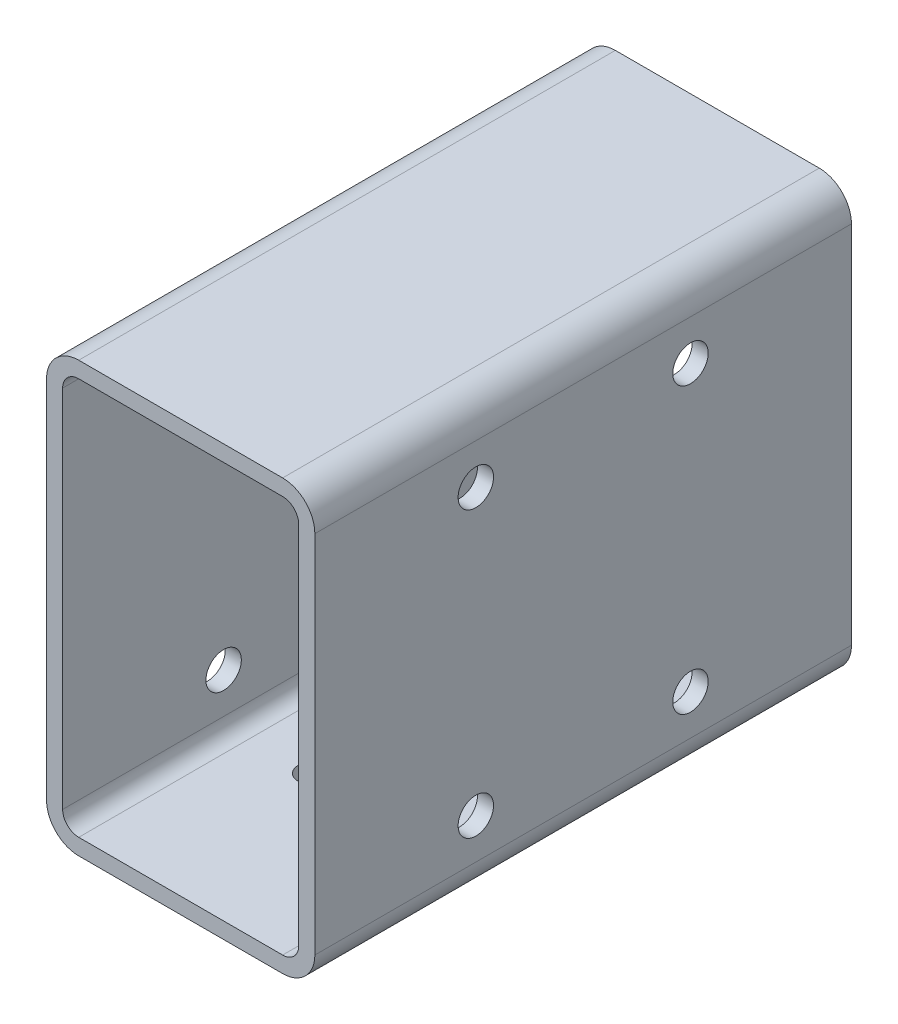
from build123d import *

# Parameters (mm, degrees)
BOSS_EXTRUDE1_DEPTH = 50
SKETCH2_R           = 3.3
CUT_EXTRUDE1_DEPTH  = 82.240384046
SKETCH3_R           = 2.5
CUT_EXTRUDE2_DEPTH  = 96.152509163


with BuildPart() as part:
    # Sketch1 → Boss-Extrude1 (new, symmetric)
    with BuildSketch(Plane.XY):
        with BuildLine():
            Line((19, 40), (-19, 40))
            ThreePointArc((-19, 40), (-23.242640687, 38.242640687), (-25, 34))
            Line((-25, 34), (-25, -34))
            ThreePointArc((-25, -34), (-23.242640687, -38.242640687), (-19, -40))
            Line((-19, -40), (19, -40))
            ThreePointArc((19, -40), (23.242640687, -38.242640687), (25, -34))
            Line((25, -34), (25, 34))
            ThreePointArc((25, 34), (23.242640687, 38.242640687), (19, 40))
        make_face()
        with BuildLine():
            Line((19, -37), (-19, -37))
            ThreePointArc((-19, -37), (-21.121320344, -36.121320344), (-22, -34))
            Line((-22, -34), (-22, 34))
            ThreePointArc((-22, 34), (-21.121320344, 36.121320344), (-19, 37))
            Line((-19, 37), (19, 37))
            ThreePointArc((19, 37), (21.121320344, 36.121320344), (22, 34))
            Line((22, 34), (22, -34))
            ThreePointArc((22, -34), (21.121320344, -36.121320344), (19, -37))
        make_face(mode=Mode.SUBTRACT)
    extrude(amount=BOSS_EXTRUDE1_DEPTH, both=True)

    # Sketch2 → Cut-Extrude1 (cut, through all)
    with BuildSketch(Plane.ZY.offset(25)):
        with Locations((-20, 26.5)):
            Circle(SKETCH2_R)
        with Locations((20, 26.5)):
            Circle(SKETCH2_R)
        with Locations((20, -26.5)):
            Circle(SKETCH2_R)
        with Locations((-20, -26.5)):
            Circle(SKETCH2_R)
    extrude(amount=-CUT_EXTRUDE1_DEPTH, mode=Mode.SUBTRACT)

    # Sketch3 → Cut-Extrude2 (cut, through all)
    with BuildSketch(Plane(origin=(0, -37, 0), x_dir=(1, 0, 0), z_dir=(0, 1, 0))):
        with Locations((-7.65, 0)):
            Circle(SKETCH3_R)
        with Locations((-7.65, 18)):
            Circle(SKETCH3_R)
        with Locations((-7.65, -18)):
            Circle(SKETCH3_R)
        with Locations((14.85, 18)):
            Circle(SKETCH3_R)
        with Locations((14.85, -18)):
            Circle(SKETCH3_R)
    extrude(amount=-CUT_EXTRUDE2_DEPTH, mode=Mode.SUBTRACT)


solid = part.part
